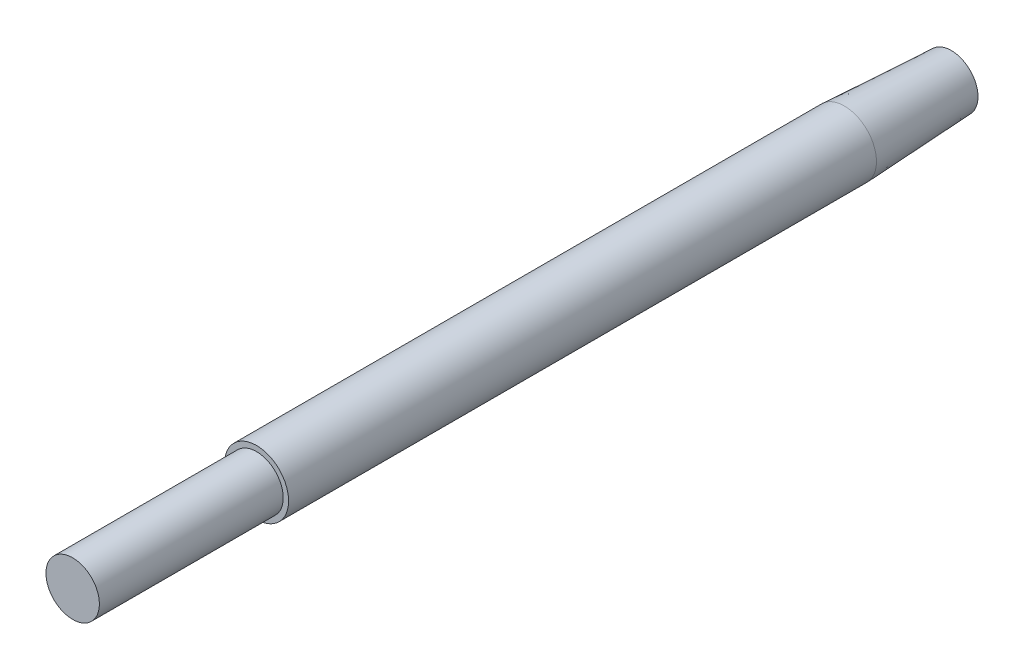
from build123d import *

# Parameters (mm, degrees)
SKETCH_1_R          = 15
EXTRUDE_1_DEPTH     = 205.5
SKETCH_2_R          = 15
SKETCH_2_R_2        = 12.5
CUT_EXTRUDE_1_DEPTH = 86


# Read off the part's stored shape, not the designer's step: 切除-旋转3
with BuildPart() as part:
    # 草图1 → 凸台-拉伸1 (new, symmetric)
    with BuildSketch(Plane.XY):
        Circle(SKETCH_1_R)
    extrude(amount=EXTRUDE_1_DEPTH, both=True)

    # 草图2 → 切除-拉伸1 (cut)
    with BuildSketch(Plane.XY.offset(205.5)):
        Circle(SKETCH_2_R)
        Circle(SKETCH_2_R_2, mode=Mode.SUBTRACT)
    extrude(amount=-CUT_EXTRUDE_1_DEPTH, mode=Mode.SUBTRACT)

    # 切除-旋转3 outline → 切除-旋转3 (revolve, cut)
    with BuildSketch(Plane.XZ):
        Polygon((15, -155.5), (12.5, -205.5), (15, -205.5), align=None)
    revolve(axis=Axis((0, 0, 0), (0, 0, 1)), mode=Mode.SUBTRACT)


solid = part.part
